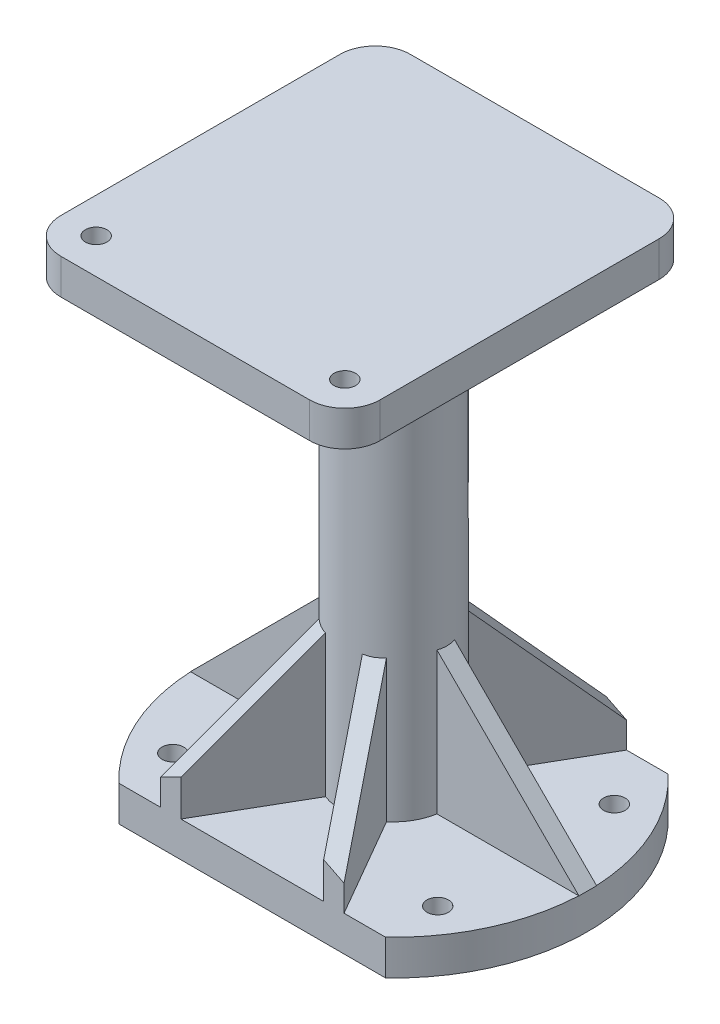
from build123d import *

# Parameters (mm, degrees)
SKETCH1_R                      = 2.55
SKETCH1_R_2                    = 11
BASE_DEPTH                     = 5
SKETCH1_3_R                    = 15
SKETCH1_3_R_2                  = 11
STEM_DEPTH                     = 150
SKETCH4_W                      = 90.4
SKETCH4_H                      = 80
TOP_PLATE_DEPTH                = 10
SKETCH6_W                      = 90.4
SKETCH6_H                      = 10
BOSS_EXTRUDE7_DEPTH            = 19
RIB1_START                     = -2.5
RIB1_DEPTH                     = 5
CIRPATTERN6_COUNT              = 6
CUT_EXTRUDE1_REACH             = 170.039
SKETCH10_R                     = 3.05
CUT_EXTRUDE1_DIRECTION_2_DEPTH = 169.039429897
FILLET1_R                      = 10
FILLET2_R                      = 10
SKETCH11_R                     = 55
NEW_BASE_DEPTH                 = 10
RIB2_START                     = -2.5
RIB2_DEPTH                     = 5
CIRPATTERN7_COUNT              = 6
SKETCH13_R                     = 3.05
CUT_EXTRUDE2_DEPTH             = 10
FILLET3_R                      = 10
SKETCH15_R                     = 11
REMOVE_CENTER_DEPTH            = 162.573512681
BASE_CUT_DEPTH                 = 40


with BuildPart() as part:
    # Sketch1 → base (new body)
    with BuildSketch(Plane(origin=(0, 0, 0), x_dir=(1, 0, 0), z_dir=(0, 1, 0))):
        with BuildLine():
            Line((-16, 25.377155081), (-42.833333333, 8.459051694))
            ThreePointArc((-42.833333333, 8.459051694), (-47.5, 0), (-42.833333333, -8.459051694))
            Line((-42.833333333, -8.459051694), (-16, -25.377155081))
            ThreePointArc((-16, -25.377155081), (0, -30), (16, -25.377155081))
            Line((16, -25.377155081), (42.833333333, -8.459051694))
            ThreePointArc((42.833333333, -8.459051694), (47.5, 0), (42.833333333, 8.459051694))
            Line((42.833333333, 8.459051694), (16, 25.377155081))
            ThreePointArc((16, 25.377155081), (0, 30), (-16, 25.377155081))
        make_face()
        with Locations(Location((-37.5, 0, 0), (0, 0, 270))):
            Circle(SKETCH1_R, mode=Mode.SUBTRACT)
        with Locations(Location((37.5, 0, 0), (0, 0, 270))):
            Circle(SKETCH1_R, mode=Mode.SUBTRACT)
        with Locations(Location((0, 0, 0), (0, 0, 270))):
            Circle(SKETCH1_R_2, mode=Mode.SUBTRACT)
    extrude(amount=BASE_DEPTH)

    # Sketch1<3> → stem (add)
    with BuildSketch(Plane(origin=(0, 0, 0), x_dir=(1, 0, 0), z_dir=(0, 1, 0))):
        with Locations(Location((0, 0, 0), (0, 0, 270))):
            Circle(SKETCH1_3_R)
        with Locations(Location((0, 0, 0), (0, 0, 270))):
            Circle(SKETCH1_3_R_2, mode=Mode.SUBTRACT)
    extrude(amount=STEM_DEPTH)

    # Sketch4 → top plate (add)
    with BuildSketch(Plane(origin=(0, 150, 0), x_dir=(1, 0, 0), z_dir=(0, 1, 0))):
        Rectangle(SKETCH4_W, SKETCH4_H)
    extrude(amount=-TOP_PLATE_DEPTH)

    # Sketch6 → Boss-Extrude7 (add)
    with BuildSketch(Plane.XY.offset(40)):
        with Locations((0, 145)):
            Rectangle(SKETCH6_W, SKETCH6_H)
    extrude(amount=BOSS_EXTRUDE7_DEPTH)

    # Rib1: read off the stored shape, not the designer's step
    # Rib1 outline → Rib1 (add)
    with BuildSketch(Plane(origin=(0, 0, 0), x_dir=(0, 0, -1), z_dir=(1, 0, 0)).offset(RIB1_START)):
        Polygon((-15, 110), (-14.790199458, 110), (-14.790199458, 140), (-40, 140), align=None)
    rib1 = extrude(amount=RIB1_DEPTH)

    # CirPattern6: Rib1 ×6 about axis
    cirpattern6_axis = Axis((0, 0, 0), (0, 1, 0))
    for i in range(1, CIRPATTERN6_COUNT):
        add(rib1.rotate(cirpattern6_axis, i * 360 / CIRPATTERN6_COUNT))

    # Sketch10 → Cut-Extrude1 (cut, up to next)
    with BuildSketch(Plane(origin=(0, 150, 0), x_dir=(1, 0, 0), z_dir=(0, 1, 0)), mode=Mode.PRIVATE) as cut_extrude1_sk1:
        with Locations(Location((35.2, -49, 0), (0, 0, 90))):
            Circle(SKETCH10_R)
    cut_extrude1_tool1 = extrude(cut_extrude1_sk1.sketch, amount=-CUT_EXTRUDE1_REACH, mode=Mode.PRIVATE) & part.part
    # Sketch10 → Cut-Extrude1 (cut, up to next)
    with BuildSketch(Plane(origin=(0, 150, 0), x_dir=(1, 0, 0), z_dir=(0, 1, 0)), mode=Mode.PRIVATE) as cut_extrude1_sk2:
        with Locations(Location((-35.2, -49, 0), (0, 0, 90))):
            Circle(SKETCH10_R)
    cut_extrude1_tool2 = extrude(cut_extrude1_sk2.sketch, amount=-CUT_EXTRUDE1_REACH, mode=Mode.PRIVATE) & part.part
    add(cut_extrude1_tool1.solids().sort_by_distance((35.2, 150, 49))[0], mode=Mode.SUBTRACT)
    add(cut_extrude1_tool2.solids().sort_by_distance((-35.2, 150, 49))[0], mode=Mode.SUBTRACT)

    # Sketch10 → Cut-Extrude1 direction 2 (cut)
    with BuildSketch(Plane(origin=(0, 150, 0), x_dir=(1, 0, 0), z_dir=(0, 1, 0))):
        with Locations(Location((35.2, -49, 0), (0, 0, 90))):
            Circle(SKETCH10_R)
        with Locations(Location((-35.2, -49, 0), (0, 0, 90))):
            Circle(SKETCH10_R)
    extrude(amount=CUT_EXTRUDE1_DIRECTION_2_DEPTH, mode=Mode.SUBTRACT)

    # Fillet1
    fillet1_edges = [part.edges().sort_by_distance(p)[0] for p in [
        (-45.2, 145, 59),
    ]]
    fillet(fillet1_edges, radius=FILLET1_R)

    # Fillet2
    fillet2_edges = [part.edges().sort_by_distance(p)[0] for p in [
        (45.2, 145, 59),
    ]]
    fillet(fillet2_edges, radius=FILLET2_R)

    # Sketch11 → new base (add)
    with BuildSketch(Plane.XZ):
        with Locations(Location((0, 0, 0), (0, 0, 270))):
            Circle(SKETCH11_R)
    extrude(amount=-NEW_BASE_DEPTH)

    # Rib2: read off the stored shape, not the designer's step
    # Rib2 outline → Rib2 (add)
    with BuildSketch(Plane.XY.offset(RIB2_START)):
        Polygon((13, 10), (55, 10), (13, 52), align=None)
    rib2 = extrude(amount=RIB2_DEPTH)

    # CirPattern7: Rib2 ×6 about axis
    cirpattern7_axis = Axis((0, 0, 0), (0, 1, 0))
    for i in range(1, CIRPATTERN7_COUNT):
        add(rib2.rotate(cirpattern7_axis, i * 360 / CIRPATTERN7_COUNT))

    # Sketch13 → Cut-Extrude2 (cut)
    with BuildSketch(Plane.XZ):
        with Locations(Location((-37.5, -25, 0), (0, 0, 270))):
            Circle(SKETCH13_R)
        with Locations(Location((-37.5, 25, 0), (0, 0, 270))):
            Circle(SKETCH13_R)
        with Locations(Location((37.5, 25, 0), (0, 0, 270))):
            Circle(SKETCH13_R)
        with Locations(Location((37.5, -25, 0), (0, 0, 270))):
            Circle(SKETCH13_R)
    extrude(amount=-CUT_EXTRUDE2_DEPTH, mode=Mode.SUBTRACT)

    # Fillet3
    fillet3_edges = [part.edges().sort_by_distance(p)[0] for p in [
        (45.2, 145, -40),
        (-45.2, 145, -40),
    ]]
    fillet(fillet3_edges, radius=FILLET3_R)

    # Sketch15 → remove center (cut, through all)
    with BuildSketch(Plane(origin=(0, 10, 0), x_dir=(1, 0, 0), z_dir=(0, 1, 0))):
        with Locations(Location((0, 0, 0), (0, 0, 270))):
            Circle(SKETCH15_R)
    extrude(amount=-REMOVE_CENTER_DEPTH, mode=Mode.SUBTRACT)

    # Sketch16 → base cut (cut)
    with BuildSketch(Plane.XZ):
        with BuildLine():
            Line((-37.749172176, 40), (37.749172176, 40))
            ThreePointArc((37.749172176, 40), (0, 55), (-37.749172176, 40))
        make_face()
        with BuildLine():
            ThreePointArc((-37.749172176, -40), (0, -55), (37.749172176, -40))
            Line((37.749172176, -40), (-37.749172176, -40))
        make_face()
    extrude(amount=-BASE_CUT_DEPTH, mode=Mode.SUBTRACT)


with BuildPart() as base_cut_kept_piece:
    # of the separate pieces the step leaves, the one the design keeps (base_cut_pieces_kept)
    add(part.part.solids().sort_by_distance((45.2, 140, -30))[0])


solid = base_cut_kept_piece.part
